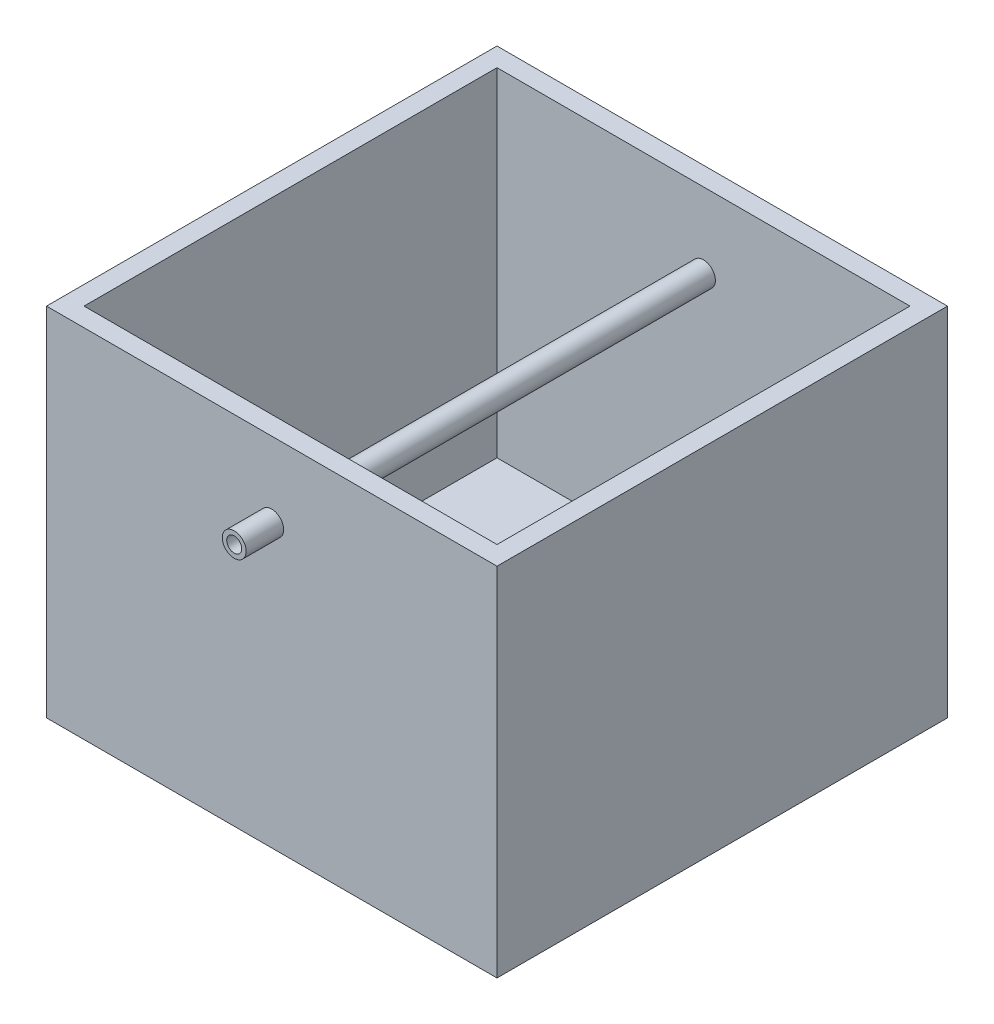
from build123d import *

# Parameters (mm, degrees)
SKETCH1_W                = 120
SKETCH1_H                = 120
BOSS_EXTRUDE1_DEPTH      = 150
SHELL1_T                 = -5
BOSS_EXTRUDE2_DEPTH      = 10
BOSS_EXTRUDE2_DEPTH_BACK = 116
SKETCH2_R                = 3.175
SKETCH2_R_2              = 2
SKETCH3_R                = 1
CUT_EXTRUDE1_DEPTH       = 70
SKETCH4_W                = 120
SKETCH4_H                = 67.243067728
CUT_EXTRUDE2_DEPTH       = 120
SKETCH5_R                = 3.175
SKETCH5_R_2              = 2
BOSS_EXTRUDE3_DEPTH      = 10
CUT_EXTRUDE3_START       = -10
SKETCH6_R                = 2
CUT_EXTRUDE3_DEPTH       = 10


with BuildPart() as part:
    # Sketch1 → Boss-Extrude1 (new body)
    with BuildSketch(Plane(origin=(0, 0, 0), x_dir=(1, 0, 0), z_dir=(0, 1, 0))):
        Rectangle(SKETCH1_W, SKETCH1_H)
    extrude(amount=BOSS_EXTRUDE1_DEPTH)

    # Shell1
    shell1_openings = [part.faces().sort_by_distance(p)[0] for p in [
        (0, 150, 0),
    ]]
    offset(amount=SHELL1_T, openings=shell1_openings, kind=Kind.INTERSECTION)

    # Sketch2 → Boss-Extrude2 (add, two sides: drawn at the far end of the back side and taken through both)
    with BuildSketch(Plane.XY.offset(60).offset(-BOSS_EXTRUDE2_DEPTH_BACK)):
        with Locations((0, 75)):
            Circle(SKETCH2_R)
        with Locations((0, 75)):
            Circle(SKETCH2_R_2, mode=Mode.SUBTRACT)
    extrude(amount=BOSS_EXTRUDE2_DEPTH + BOSS_EXTRUDE2_DEPTH_BACK)

    # Sketch3 → Cut-Extrude1 (cut)
    with BuildSketch(Plane(origin=(0, 5, 0), x_dir=(1, 0, 0), z_dir=(0, 1, 0))):
        Circle(SKETCH3_R)
        with Locations((0, 7.5)):
            Circle(SKETCH3_R)
        with Locations((0, -7.5)):
            Circle(SKETCH3_R)
        with Locations((0, -15)):
            Circle(SKETCH3_R)
        with Locations((0, 15)):
            Circle(SKETCH3_R)
        with Locations((0, -22.5)):
            Circle(SKETCH3_R)
        with Locations((0, 22.5)):
            Circle(SKETCH3_R)
        with Locations((0, -30)):
            Circle(SKETCH3_R)
        with Locations((0, 30)):
            Circle(SKETCH3_R)
        with Locations((0, -37.5)):
            Circle(SKETCH3_R)
        with Locations((0, 37.5)):
            Circle(SKETCH3_R)
        with Locations((0, -45)):
            Circle(SKETCH3_R)
        with Locations((0, 45)):
            Circle(SKETCH3_R)
    extrude(amount=CUT_EXTRUDE1_DEPTH, mode=Mode.SUBTRACT)

    # Sketch4 → Cut-Extrude2 (cut)
    with BuildSketch(Plane.XY.offset(60)):
        with Locations((0, 128.621533864)):
            Rectangle(SKETCH4_W, SKETCH4_H)
    extrude(amount=-CUT_EXTRUDE2_DEPTH, mode=Mode.SUBTRACT)

    # Sketch5 → Boss-Extrude3 (add)
    with BuildSketch(Plane.ZY.offset(60)):
        with Locations((0, 27.5)):
            Circle(SKETCH5_R)
        with Locations((0, 27.5)):
            Circle(SKETCH5_R_2, mode=Mode.SUBTRACT)
    extrude(amount=BOSS_EXTRUDE3_DEPTH)

    # Sketch6 → Cut-Extrude3 (cut)
    with BuildSketch(Plane.ZY.offset(60).offset(CUT_EXTRUDE3_START)):
        with Locations((0, 27.5)):
            Circle(SKETCH6_R)
    extrude(amount=CUT_EXTRUDE3_DEPTH, mode=Mode.SUBTRACT)


solid = part.part
